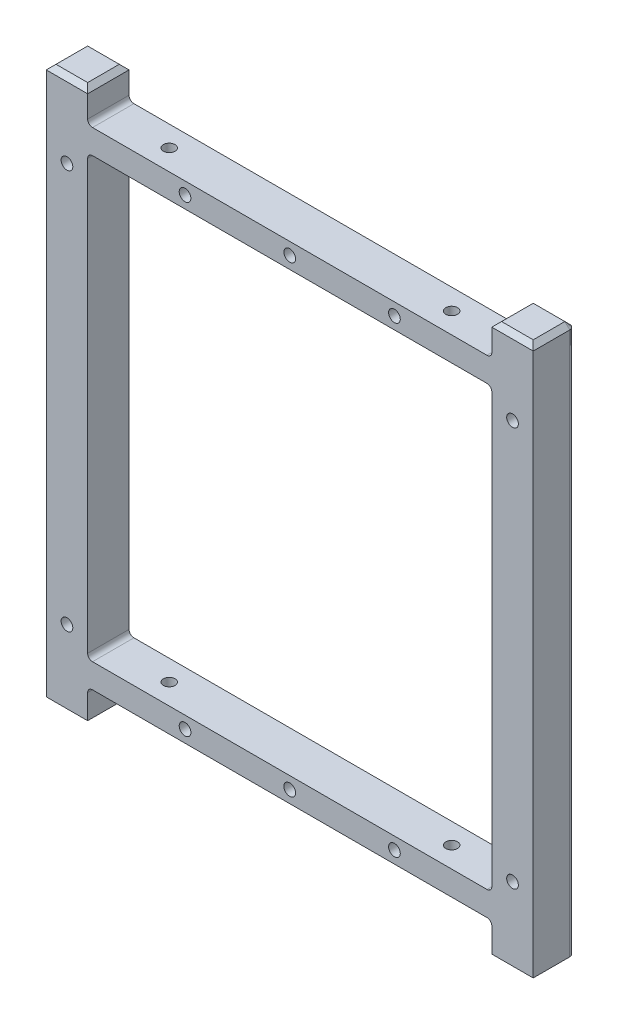
from build123d import *

# Parameters (mm, degrees)
SKETCH1_W           = 100
SKETCH1_H           = 113.5
BOSS_EXTRUDE1_DEPTH = 4.25
CUT_EXTRUDE1_DEPTH  = 77.110528181
M2_HOLE1_C_D        = 2.4
M2_HOLE1_C_DEPTH    = 3
M2_HOLE1_C_TIP      = 0.721032743
M2_HOLE2_D_D        = 2.4
M2_HOLE2_D_DEPTH    = 5
M2_HOLE2_D_TIP      = 0.721032743
M2_HOLE3_E_D        = 2.4
M2_HOLE3_E_DEPTH    = 4
M2_HOLE3_E_TIP      = 0.721032743
M2_HOLE4_F_D        = 2.4
M2_HOLE4_F_DEPTH    = 10
M2_HOLE4_F_TIP      = 0.721032743
M2_HOLE5_G_D        = 2.4
M2_HOLE5_G_DEPTH    = 10
M2_HOLE5_G_TIP      = 0.721032743
M2_HOLE6_H_D        = 2.4
M2_HOLE6_H_DEPTH    = 5
M2_HOLE6_H_TIP      = 0.721032743
FILLET1_R           = 1
CHAMFER1_SIZE       = 1


with BuildPart() as part:
    # Sketch1 → Boss-Extrude1 (new, symmetric)
    with BuildSketch(Plane.XY):
        Rectangle(SKETCH1_W, SKETCH1_H)
    extrude(amount=BOSS_EXTRUDE1_DEPTH, both=True)

    # Sketch4 → Cut-Extrude1 (cut, through all)
    with BuildSketch(Plane.XY.offset(4.25)):
        with BuildLine():
            Line((-40.5, -44.75), (40.5, -44.75))
            ThreePointArc((40.5, -44.75), (41.207106781, -44.457106781), (41.5, -43.75))
            Line((41.5, -43.75), (41.5, 44.25))
            ThreePointArc((41.5, 44.25), (41.207106781, 44.957106781), (40.5, 45.25))
            Line((40.5, 45.25), (-40.5, 45.25))
            ThreePointArc((-40.5, 45.25), (-41.207106781, 44.957106781), (-41.5, 44.25))
            Line((-41.5, 44.25), (-41.5, -43.75))
            ThreePointArc((-41.5, -43.75), (-41.207106781, -44.457106781), (-40.5, -44.75))
        make_face()
        with BuildLine():
            Line((-41.5, 56.75), (41.5, 56.75))
            Line((41.5, 56.75), (41.5, 51.25))
            ThreePointArc((41.5, 51.25), (41.207106781, 50.542893219), (40.5, 50.25))
            Line((40.5, 50.25), (-40.5, 50.25))
            ThreePointArc((-40.5, 50.25), (-41.207106781, 50.542893219), (-41.5, 51.25))
            Line((-41.5, 51.25), (-41.5, 56.75))
        make_face()
        with BuildLine():
            Line((-41.5, -56.75), (41.5, -56.75))
            Line((41.5, -56.75), (41.5, -50.75))
            ThreePointArc((41.5, -50.75), (41.207106781, -50.042893219), (40.5, -49.75))
            Line((40.5, -49.75), (-40.5, -49.75))
            ThreePointArc((-40.5, -49.75), (-41.207106781, -50.042893219), (-41.5, -50.75))
            Line((-41.5, -50.75), (-41.5, -56.75))
        make_face()
    extrude(amount=-CUT_EXTRUDE1_DEPTH, mode=Mode.SUBTRACT)

    # M2 Hole1-C
    with Locations(Plane.XY.offset(4.25)):
        with Locations((-45.75, -40.75), (45.75, -40.75), (-45.75, 41.25), (45.75, 41.25)):
            Hole(M2_HOLE1_C_D / 2, depth=M2_HOLE1_C_DEPTH)
            with Locations((0, 0, -(M2_HOLE1_C_DEPTH + M2_HOLE1_C_TIP / 2))):  # 118° drill point
                Cone(0, M2_HOLE1_C_D / 2, M2_HOLE1_C_TIP, mode=Mode.SUBTRACT)

    # M2 Hole2-D
    with Locations(Plane.XY.offset(4.25)):
        with Locations((-21.5, 47.75), (21.5, 47.75), (-21.5, -47.25), (21.5, -47.25)):
            Hole(M2_HOLE2_D_D / 2, depth=M2_HOLE2_D_DEPTH)
            with Locations((0, 0, -(M2_HOLE2_D_DEPTH + M2_HOLE2_D_TIP / 2))):  # 118° drill point
                Cone(0, M2_HOLE2_D_D / 2, M2_HOLE2_D_TIP, mode=Mode.SUBTRACT)

    # M2 Hole3-E
    with Locations(Plane.XY.offset(4.25)):
        with Locations((0, 47.75), (0, -47.25)):
            Hole(M2_HOLE3_E_D / 2, depth=M2_HOLE3_E_DEPTH)
            with Locations((0, 0, -(M2_HOLE3_E_DEPTH + M2_HOLE3_E_TIP / 2))):  # 118° drill point
                Cone(0, M2_HOLE3_E_D / 2, M2_HOLE3_E_TIP, mode=Mode.SUBTRACT)

    # M2 Hole4-F
    with Locations(Plane(origin=(0, 50.25, 0), x_dir=(1, 0, 0), z_dir=(0, 1, 0))):
        with Locations((-29, 0), (29, 0)):
            Hole(M2_HOLE4_F_D / 2, depth=M2_HOLE4_F_DEPTH)
            with Locations((0, 0, -(M2_HOLE4_F_DEPTH + M2_HOLE4_F_TIP / 2))):  # 118° drill point
                Cone(0, M2_HOLE4_F_D / 2, M2_HOLE4_F_TIP, mode=Mode.SUBTRACT)

    # M2 Hole5-G
    with Locations(Plane(origin=(0, -49.75, 0), x_dir=(-1, 0, 0), z_dir=(0, -1, 0))):
        with Locations((29, 0), (-29, 0)):
            Hole(M2_HOLE5_G_D / 2, depth=M2_HOLE5_G_DEPTH)
            with Locations((0, 0, -(M2_HOLE5_G_DEPTH + M2_HOLE5_G_TIP / 2))):  # 118° drill point
                Cone(0, M2_HOLE5_G_D / 2, M2_HOLE5_G_TIP, mode=Mode.SUBTRACT)

    # M2 Hole6-H
    with Locations(Plane(origin=(0, 0, -4.25), x_dir=(-1, 0, 0), z_dir=(0, 0, -1))):
        with Locations((-35.5, 47.75), (35.5, 47.75), (-35.5, -47.25), (35.5, -47.25)):
            Hole(M2_HOLE6_H_D / 2, depth=M2_HOLE6_H_DEPTH)
            with Locations((0, 0, -(M2_HOLE6_H_DEPTH + M2_HOLE6_H_TIP / 2))):  # 118° drill point
                Cone(0, M2_HOLE6_H_D / 2, M2_HOLE6_H_TIP, mode=Mode.SUBTRACT)

    # Fillet1
    fillet1_edges = [part.edges().sort_by_distance(p)[0] for p in [
        (-50, 0, -4.25),
        (50, 0, -4.25),
    ]]
    fillet(fillet1_edges, radius=FILLET1_R)

    # Chamfer1
    chamfer1_edges = [part.edges().sort_by_distance(p)[0] for p in [
        (-45.75, -56.75, 4.25),
        (45.25, -56.75, -4.25),
        (45.75, -56.75, 4.25),
        (-45.25, -56.75, -4.25),
        (-49.707106781, -56.75, -3.957106781),
        (45.25, 56.75, -4.25),
        (-49.707106781, 56.75, -3.957106781),
        (49.707106781, 56.75, -3.957106781),
        (49.707106781, -56.75, -3.957106781),
        (41.5, -56.75, 0),
        (-41.5, -56.75, 0),
        (-45.25, 56.75, -4.25),
        (-45.75, 56.75, 4.25),
        (-41.5, 56.75, 0),
        (41.5, 56.75, 0),
        (45.75, 56.75, 4.25),
        (50, -56.75, 0.5),
        (-50, -56.75, 0.5),
        (-50, 56.75, 0.5),
        (50, 56.75, 0.5),
    ]]
    chamfer(chamfer1_edges, length=CHAMFER1_SIZE - 0.0001)  # a hair under: the kernel refuses the full size


solid = part.part
